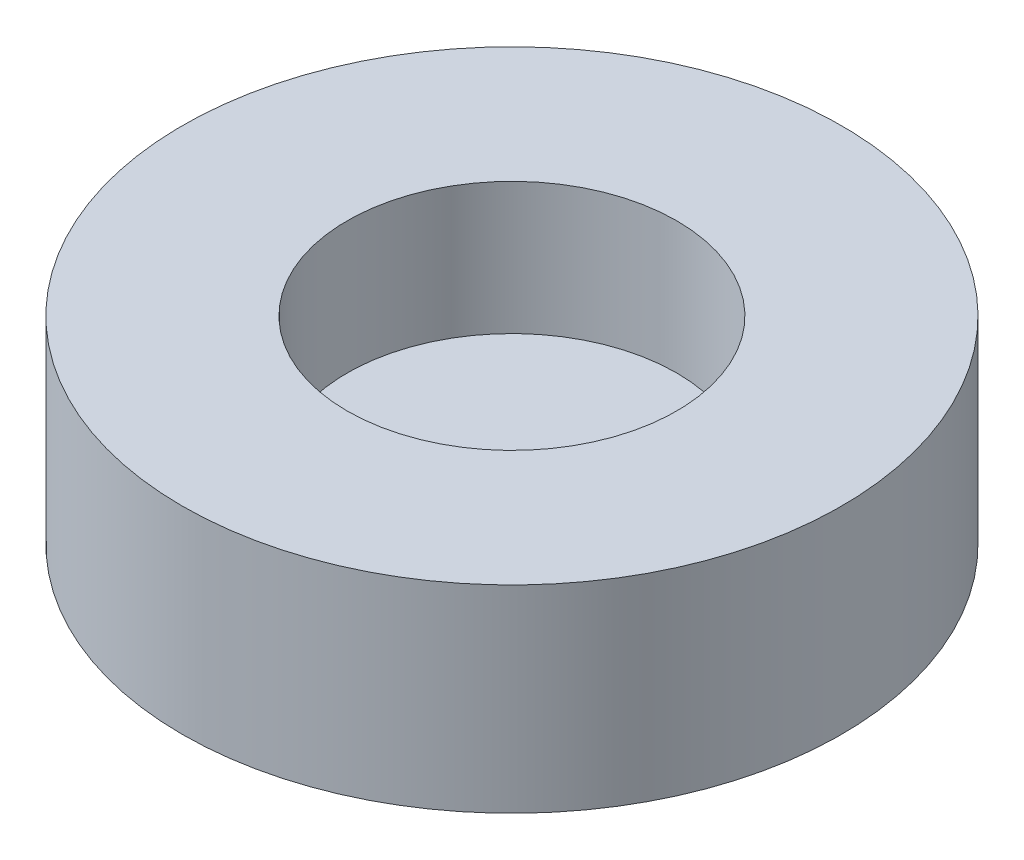
from build123d import *

# Parameters (mm, degrees)
SKETCH1_R           = 10
BOSS_EXTRUDE2_DEPTH = 6
SKETCH3_R           = 5
CUT_EXTRUDE1_DEPTH  = 4


with BuildPart() as part:
    # Sketch1 → Boss-Extrude2 (new body)
    with BuildSketch(Plane(origin=(0, 0, 0), x_dir=(1, 0, 0), z_dir=(0, 1, 0))):
        Circle(SKETCH1_R)
    extrude(amount=BOSS_EXTRUDE2_DEPTH)

    # Sketch3 → Cut-Extrude1 (cut)
    with BuildSketch(Plane(origin=(0, 6, 0), x_dir=(1, 0, 0), z_dir=(0, 1, 0))):
        Circle(SKETCH3_R)
    extrude(amount=-CUT_EXTRUDE1_DEPTH, mode=Mode.SUBTRACT)


solid = part.part
